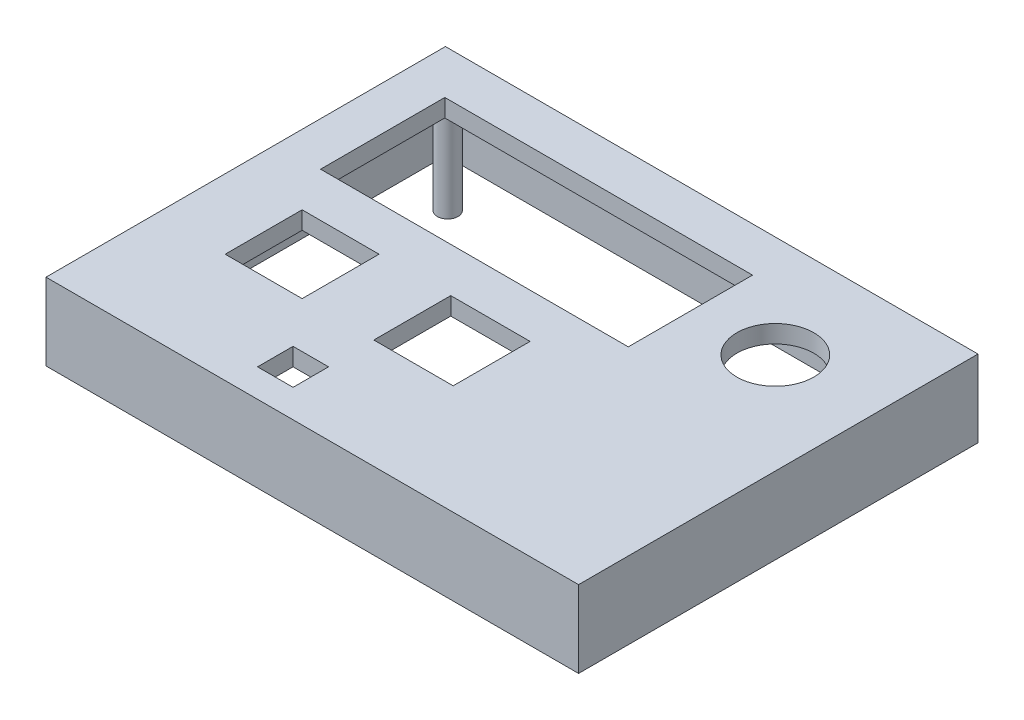
from build123d import *

# Parameters (mm, degrees)
SKETCH1_W           = 13
SKETCH1_H           = 13
SKETCH1_W_2         = 13.406613497
SKETCH1_W_3         = 52
SKETCH1_H_2         = 21
SKETCH1_R           = 6.5
BOSS_EXTRUDE1_DEPTH = 3
SKETCH2_W           = 90
SKETCH2_H           = 67.5
SKETCH2_W_2         = 84
SKETCH2_H_2         = 61.5
BOSS_EXTRUDE2_DEPTH = 10
SKETCH3_R           = 1.75
BOSS_EXTRUDE3_DEPTH = 15


with BuildPart() as part:
    # Sketch1 → Boss-Extrude1 (new body)
    with BuildSketch(Plane(origin=(0, 0, 0), x_dir=(1, 0, 0), z_dir=(0, 1, 0))):
        Polygon((-45, 33.75), (-45, -33.75), (-11, -33.75), (45, -33.75), (45, 33.75), align=None)
        Polygon((-8, -29), (-11, -29), (-14, -29), (-14, -23), (-8, -23), align=None, mode=Mode.SUBTRACT)
        with Locations((-26.716961343, -8.75)):
            Rectangle(SKETCH1_W, SKETCH1_H, mode=Mode.SUBTRACT)
        with Locations((-1.396693251, -8.75)):
            Rectangle(SKETCH1_W_2, SKETCH1_H, mode=Mode.SUBTRACT)
        with Locations((-11.6, 15.75)):
            Rectangle(SKETCH1_W_3, SKETCH1_H_2, mode=Mode.SUBTRACT)
        with Locations((28, 16.5)):
            Circle(SKETCH1_R, mode=Mode.SUBTRACT)
    extrude(amount=BOSS_EXTRUDE1_DEPTH)

    # Sketch2 → Boss-Extrude2 (add)
    with BuildSketch(Plane.XZ):
        Rectangle(SKETCH2_W, SKETCH2_H)
        Rectangle(SKETCH2_W_2, SKETCH2_H_2, mode=Mode.SUBTRACT)
    extrude(amount=BOSS_EXTRUDE2_DEPTH)

    # Sketch3 → Boss-Extrude3 (add)
    with BuildSketch(Plane.XZ):
        with Locations((-38.8, -27.93)):
            Circle(SKETCH3_R)
    extrude(amount=BOSS_EXTRUDE3_DEPTH)


solid = part.part
